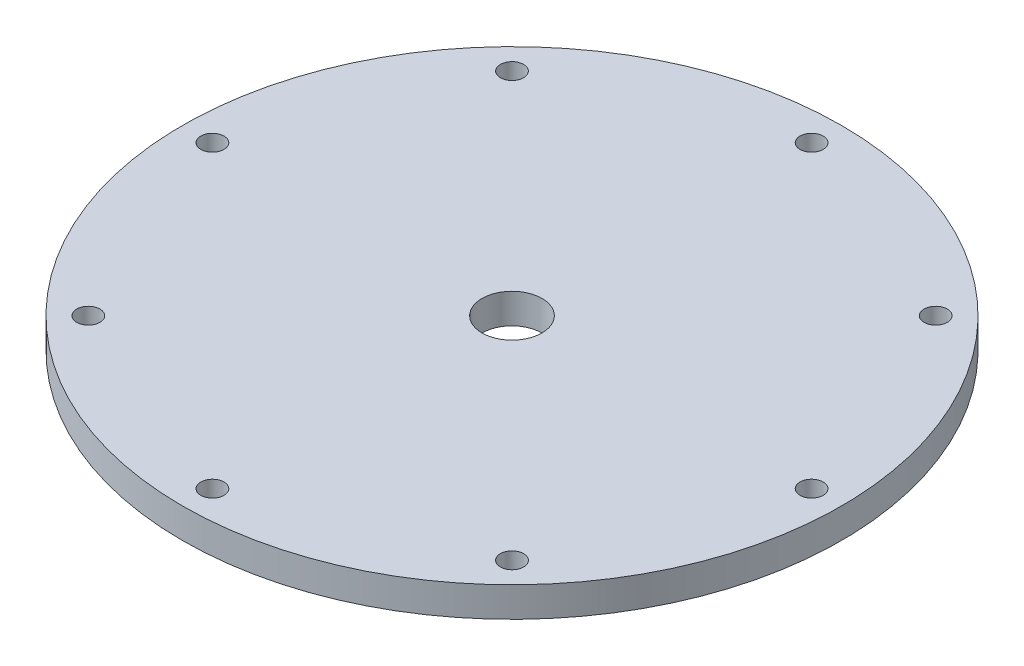
from build123d import *

# Parameters (mm, degrees)
SKETCH1_R                    = 69.85
SKETCH1_R_2                  = 6.35
BOSS_EXTRUDE1_DEPTH          = 6.35
F_10_0_1935_DIAMETER_HOLE1_D = 4.9149
CIRPATTERN1_COUNT            = 8


with BuildPart() as part:
    # Sketch1 → Boss-Extrude1 (new body)
    with BuildSketch(Plane(origin=(0, 0, 0), x_dir=(1, 0, 0), z_dir=(0, 1, 0))):
        Circle(SKETCH1_R)
        Circle(SKETCH1_R_2, mode=Mode.SUBTRACT)
    extrude(amount=BOSS_EXTRUDE1_DEPTH)

    # #10 (0.1935) Diameter Hole1 (through all)
    with Locations(Plane(origin=(63.5, 0, 0), x_dir=(0, 0, -1), z_dir=(0, -1, 0))):
        with Locations((0, 0)):
            f_10_0_1935_diameter_hole1 = Hole(F_10_0_1935_DIAMETER_HOLE1_D / 2)

    # CirPattern1: #10 (0.1935) Diameter Hole1 ×8 about axis
    cirpattern1_axis = Axis((0, 6.35, 0), (0, -1, 0))
    for i in range(1, CIRPATTERN1_COUNT):
        add(f_10_0_1935_diameter_hole1.rotate(cirpattern1_axis, i * 360 / CIRPATTERN1_COUNT), mode=Mode.SUBTRACT)


solid = part.part
